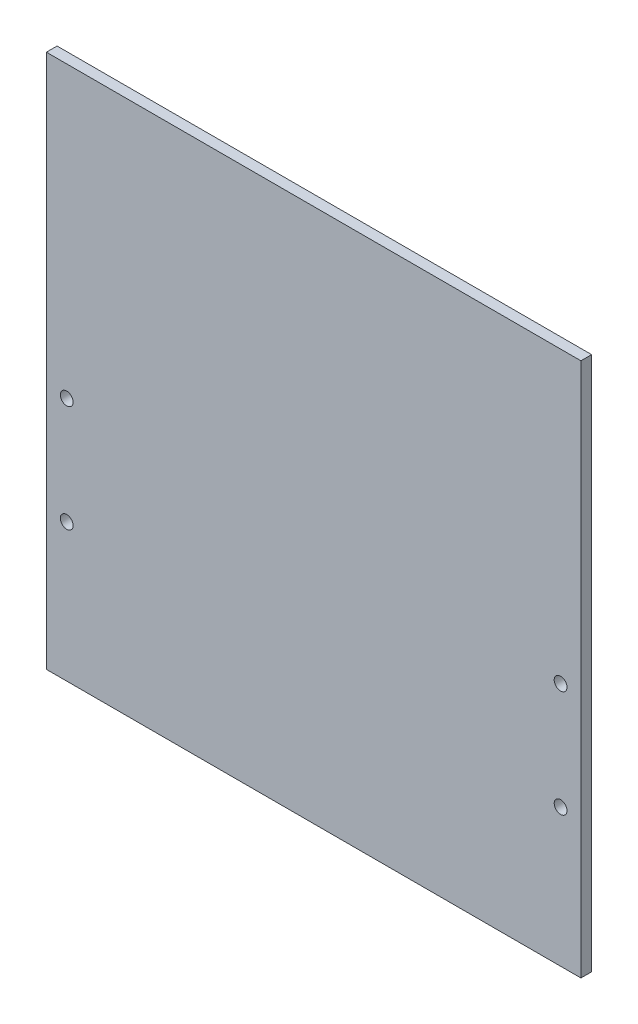
from build123d import *

# Parameters (mm, degrees)
SKETCH1_W           = 250
SKETCH1_H           = 250
SKETCH1_R           = 3
BOSS_EXTRUDE1_DEPTH = 5


with BuildPart() as part:
    # Sketch1 → Boss-Extrude1 (new body)
    with BuildSketch(Plane.XY):
        Rectangle(SKETCH1_W, SKETCH1_H)
        with Locations((-115.5, -10.500000001)):
            Circle(SKETCH1_R, mode=Mode.SUBTRACT)
        with Locations((-115.5, -60.500000001)):
            Circle(SKETCH1_R, mode=Mode.SUBTRACT)
        with Locations((115.5, -10.500000001)):
            Circle(SKETCH1_R, mode=Mode.SUBTRACT)
        with Locations((115.5, -60.500000001)):
            Circle(SKETCH1_R, mode=Mode.SUBTRACT)
    extrude(amount=BOSS_EXTRUDE1_DEPTH)


solid = part.part
